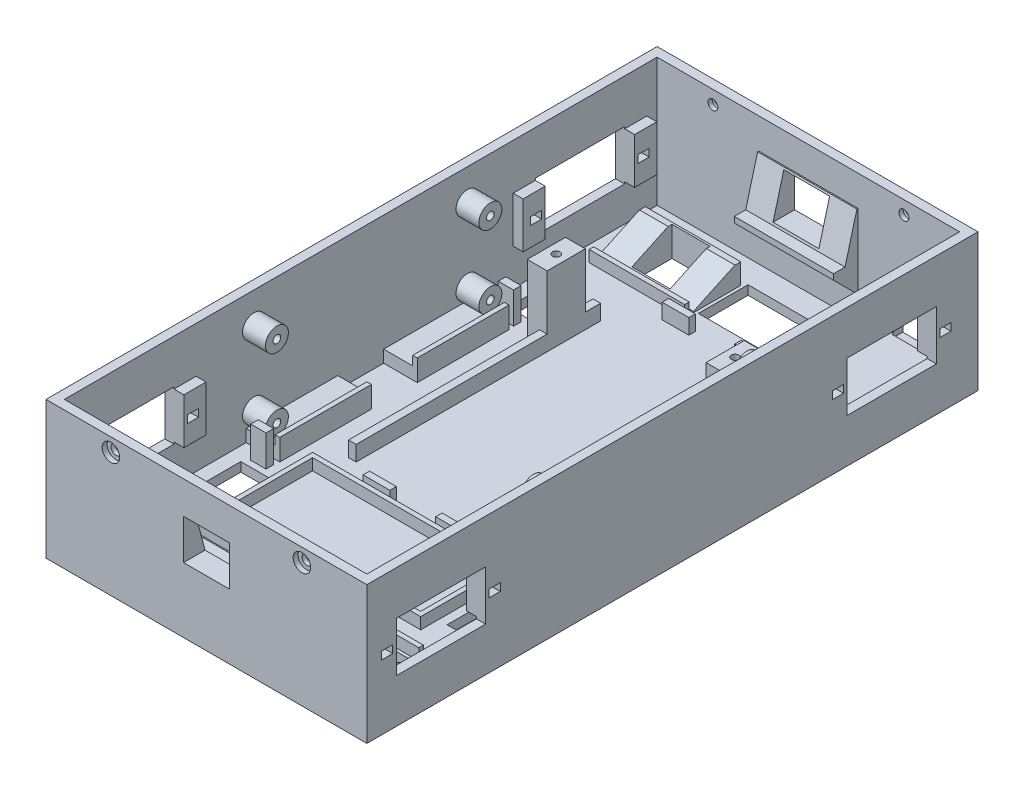
from build123d import *

# Parameters (mm, degrees)
BOSS_EXTRUDE1_START  = -80
SKETCH1_W            = 84
SKETCH1_H            = 36
BOSS_EXTRUDE1_DEPTH  = 160
BOSS_EXTRUDE2_START  = -77.6
SKETCH2_W            = 79.2
SKETCH2_H            = 38.6
BOSS_EXTRUDE2_DEPTH  = 155.2
BOSS_EXTRUDE3_START  = -74.9
SKETCH3_W            = 2.6
SKETCH3_H            = 12
BOSS_EXTRUDE3_DEPTH  = 35
BOSS_EXTRUDE4_START  = -69.1
SKETCH4_W            = 7.8
SKETCH4_H            = 13
BOSS_EXTRUDE4_DEPTH  = 23.4
BOSS_EXTRUDE5_START  = -72.925
SKETCH5_W            = 7.8
SKETCH5_H            = 2
BOSS_EXTRUDE5_DEPTH  = 2.9
BOSS_EXTRUDE6_START  = -44.775
SKETCH6_W            = 7.8
SKETCH6_H            = 2
BOSS_EXTRUDE6_DEPTH  = 2.9
BOSS_EXTRUDE7_START  = -45
SKETCH7_W            = 8
SKETCH7_H            = 4.4
BOSS_EXTRUDE7_DEPTH  = 10
BOSS_EXTRUDE8_START  = 43.1
SKETCH8_W            = 2.6
SKETCH8_H            = 12
BOSS_EXTRUDE8_DEPTH  = 34.5
BOSS_EXTRUDE9_START  = 48.9
SKETCH9_W            = 7.8
SKETCH9_H            = 13
BOSS_EXTRUDE9_DEPTH  = 23.4
BOSS_EXTRUDE10_START = 45.075
SKETCH10_W           = 7.8
SKETCH10_H           = 2
BOSS_EXTRUDE10_DEPTH = 2.9
BOSS_EXTRUDE11_START = 73.225
SKETCH11_W           = 7.8
SKETCH11_H           = 2
BOSS_EXTRUDE11_DEPTH = 2.9
BOSS_EXTRUDE12_START = 35
SKETCH12_W           = 8
SKETCH12_H           = 4.4
BOSS_EXTRUDE12_DEPTH = 10
BOSS_EXTRUDE13_START = -39.6
SKETCH13_R           = 3
BOSS_EXTRUDE13_DEPTH = 6
BOSS_EXTRUDE14_START = -40.4
SKETCH14_R           = 1
BOSS_EXTRUDE14_DEPTH = 7.4
BOSS_EXTRUDE15_START = -39.6
SKETCH15_R           = 3
BOSS_EXTRUDE15_DEPTH = 6
BOSS_EXTRUDE16_START = -40.4
SKETCH16_R           = 1
BOSS_EXTRUDE16_DEPTH = 7.4
BOSS_EXTRUDE17_START = -39.6
SKETCH17_R           = 3
BOSS_EXTRUDE17_DEPTH = 6
BOSS_EXTRUDE18_START = -40.4
SKETCH18_R           = 1
BOSS_EXTRUDE18_DEPTH = 7.4
BOSS_EXTRUDE19_START = -39.6
SKETCH19_R           = 3
BOSS_EXTRUDE19_DEPTH = 6
BOSS_EXTRUDE20_START = -40.4
SKETCH20_R           = 1
BOSS_EXTRUDE20_DEPTH = 7.4
BOSS_EXTRUDE21_START = -30
SKETCH21_W           = 7.6
SKETCH21_H           = 3.2
BOSS_EXTRUDE21_DEPTH = 24
BOSS_EXTRUDE22_START = -30
SKETCH22_W           = 1.2
SKETCH22_H           = 5.6
BOSS_EXTRUDE22_DEPTH = 24
BOSS_EXTRUDE23_START = 6
SKETCH23_W           = 7.6
SKETCH23_H           = 3.2
BOSS_EXTRUDE23_DEPTH = 24
BOSS_EXTRUDE24_START = 6
SKETCH24_W           = 1.2
SKETCH24_H           = 5.6
BOSS_EXTRUDE24_DEPTH = 24
BOSS_EXTRUDE25_START = 31.4
SKETCH25_W           = 4
SKETCH25_H           = 8.2
BOSS_EXTRUDE25_DEPTH = 2
BOSS_EXTRUDE26_START = -33.4
SKETCH26_W           = 4
SKETCH26_H           = 8.2
BOSS_EXTRUDE26_DEPTH = 2
BOSS_EXTRUDE27_START = -44
SKETCH27_W           = 2
SKETCH27_H           = 4
BOSS_EXTRUDE27_DEPTH = 64
BOSS_EXTRUDE28_START = -40
SKETCH28_W           = 5.2
SKETCH28_H           = 18.35
BOSS_EXTRUDE28_DEPTH = 10
BOSS_EXTRUDE29_START = 8
SKETCH29_R           = 1
BOSS_EXTRUDE29_DEPTH = 13.75
BOSS_EXTRUDE30_START = 27.7
SKETCH30_W           = 1.2
SKETCH30_H           = 3
BOSS_EXTRUDE30_DEPTH = 20.7
BOSS_EXTRUDE31_START = -74.9
SKETCH31_W           = 2.6
SKETCH31_H           = 12
BOSS_EXTRUDE31_DEPTH = 35
BOSS_EXTRUDE32_START = -69.1
SKETCH32_W           = 7.8
SKETCH32_H           = 13
BOSS_EXTRUDE32_DEPTH = 23.4
BOSS_EXTRUDE33_START = -72.925
SKETCH33_W           = 7.8
SKETCH33_H           = 2
BOSS_EXTRUDE33_DEPTH = 2.9
BOSS_EXTRUDE34_START = -44.775
SKETCH34_W           = 7.8
SKETCH34_H           = 2
BOSS_EXTRUDE34_DEPTH = 2.9
BOSS_EXTRUDE35_START = -45
SKETCH35_W           = 8
SKETCH35_H           = 4.4
BOSS_EXTRUDE35_DEPTH = 10
BOSS_EXTRUDE36_START = 43.1
SKETCH36_W           = 2.6
SKETCH36_H           = 12
BOSS_EXTRUDE36_DEPTH = 34.5
BOSS_EXTRUDE37_START = 48.9
SKETCH37_W           = 7.8
SKETCH37_H           = 13
BOSS_EXTRUDE37_DEPTH = 23.4
BOSS_EXTRUDE38_START = 45.075
SKETCH38_W           = 7.8
SKETCH38_H           = 2
BOSS_EXTRUDE38_DEPTH = 2.9
BOSS_EXTRUDE39_START = 73.225
SKETCH39_W           = 7.8
SKETCH39_H           = 2
BOSS_EXTRUDE39_DEPTH = 2.9
BOSS_EXTRUDE40_START = 35
SKETCH40_W           = 8
SKETCH40_H           = 4.4
BOSS_EXTRUDE40_DEPTH = 10
BOSS_EXTRUDE41_START = 33.6
SKETCH41_R           = 3
BOSS_EXTRUDE41_DEPTH = 6
BOSS_EXTRUDE42_START = 33
SKETCH42_R           = 1
BOSS_EXTRUDE42_DEPTH = 7.4
BOSS_EXTRUDE43_START = 33.6
SKETCH43_R           = 3
BOSS_EXTRUDE43_DEPTH = 6
BOSS_EXTRUDE44_START = 33
SKETCH44_R           = 1
BOSS_EXTRUDE44_DEPTH = 7.4
BOSS_EXTRUDE45_START = 33.6
SKETCH45_R           = 3
BOSS_EXTRUDE45_DEPTH = 6
BOSS_EXTRUDE46_START = 33
SKETCH46_R           = 1
BOSS_EXTRUDE46_DEPTH = 7.4
BOSS_EXTRUDE47_START = 33.6
SKETCH47_R           = 3
BOSS_EXTRUDE47_DEPTH = 6
BOSS_EXTRUDE48_START = 33
SKETCH48_R           = 1
BOSS_EXTRUDE48_DEPTH = 7.4
BOSS_EXTRUDE49_START = -30
SKETCH49_W           = 7.6
SKETCH49_H           = 3.2
BOSS_EXTRUDE49_DEPTH = 24
BOSS_EXTRUDE50_START = -30
SKETCH50_W           = 1.2
SKETCH50_H           = 5.6
BOSS_EXTRUDE50_DEPTH = 24
BOSS_EXTRUDE51_START = 6
SKETCH51_W           = 7.6
SKETCH51_H           = 3.2
BOSS_EXTRUDE51_DEPTH = 24
BOSS_EXTRUDE52_START = 6
SKETCH52_W           = 1.2
SKETCH52_H           = 5.6
BOSS_EXTRUDE52_DEPTH = 24
BOSS_EXTRUDE53_START = 31.4
SKETCH53_W           = 4
SKETCH53_H           = 8.2
BOSS_EXTRUDE53_DEPTH = 2
BOSS_EXTRUDE54_START = -33.4
SKETCH54_W           = 4
SKETCH54_H           = 8.2
BOSS_EXTRUDE54_DEPTH = 2
BOSS_EXTRUDE55_START = -44
SKETCH55_W           = 2
SKETCH55_H           = 4
BOSS_EXTRUDE55_DEPTH = 64
BOSS_EXTRUDE56_START = -40
SKETCH56_W           = 5.2
SKETCH56_H           = 18.35
BOSS_EXTRUDE56_DEPTH = 10
BOSS_EXTRUDE57_START = 8
SKETCH57_R           = 1
BOSS_EXTRUDE57_DEPTH = 13.75
BOSS_EXTRUDE58_START = 27.7
SKETCH58_W           = 1.2
SKETCH58_H           = 3
BOSS_EXTRUDE58_DEPTH = 20.7
BOSS_EXTRUDE59_START = 26.5
SKETCH59_W           = 51.4
SKETCH59_H           = 3
BOSS_EXTRUDE59_DEPTH = 1.2
BOSS_EXTRUDE60_START = 48.4
SKETCH60_W           = 51.4
SKETCH60_H           = 3
BOSS_EXTRUDE60_DEPTH = 1.2
BOSS_EXTRUDE61_START = -54
SKETCH61_W           = 7
SKETCH61_H           = 4
BOSS_EXTRUDE61_DEPTH = 1.7
BOSS_EXTRUDE62_START = -54
SKETCH62_W           = 7
SKETCH62_H           = 4
BOSS_EXTRUDE62_DEPTH = 1.7
BOSS_EXTRUDE63_START = 24.3
SKETCH63_W           = 7
SKETCH63_H           = 4
BOSS_EXTRUDE63_DEPTH = 1.7
BOSS_EXTRUDE64_START = 24.3
SKETCH64_W           = 7
SKETCH64_H           = 4
BOSS_EXTRUDE64_DEPTH = 1.7
BOSS_EXTRUDE65_START = -32.5
BOSS_EXTRUDE65_DEPTH = 25
BOSS_EXTRUDE66_START = 55.7
SKETCH66_W           = 25
SKETCH66_H           = 3
BOSS_EXTRUDE66_DEPTH = 1.2
BOSS_EXTRUDE67_START = 59.4
SKETCH67_W           = 10
SKETCH67_H           = 9.771419141
BOSS_EXTRUDE67_DEPTH = 10.475693444
BOSS_EXTRUDE68_START = 7.5
BOSS_EXTRUDE68_DEPTH = 25
BOSS_EXTRUDE69_START = 55.7
SKETCH69_W           = 25
SKETCH69_H           = 3
BOSS_EXTRUDE69_DEPTH = 1.2
BOSS_EXTRUDE70_START = 59.4
SKETCH70_W           = 10
SKETCH70_H           = 9.771419141
BOSS_EXTRUDE70_DEPTH = 10.475693444
BOSS_EXTRUDE71_START = -35.5
BOSS_EXTRUDE71_DEPTH = 25
BOSS_EXTRUDE72_START = -56.9
SKETCH72_W           = 25
SKETCH72_H           = 3
BOSS_EXTRUDE72_DEPTH = 1.2
BOSS_EXTRUDE73_START = -69.875693444
SKETCH73_W           = 10
SKETCH73_H           = 9.771419141
BOSS_EXTRUDE73_DEPTH = 10.475693444
BOSS_EXTRUDE74_START = -13
BOSS_EXTRUDE74_DEPTH = 26
BOSS_EXTRUDE75_START = -81
SKETCH75_W           = 12
SKETCH75_H           = 10.5
BOSS_EXTRUDE75_DEPTH = 7
BOSS_EXTRUDE76_START = -13
BOSS_EXTRUDE76_DEPTH = 26
BOSS_EXTRUDE77_START = 74
SKETCH77_W           = 12
SKETCH77_H           = 10.5
BOSS_EXTRUDE77_DEPTH = 7
BOSS_EXTRUDE78_START = -71.5
SKETCH78_W           = 19.4
SKETCH78_H           = 4.4
BOSS_EXTRUDE78_DEPTH = 13
BOSS_EXTRUDE79_START = -77.6
SKETCH79_W           = 18
SKETCH79_H           = 2
BOSS_EXTRUDE79_DEPTH = 31
BOSS_EXTRUDE80_START = -75
SKETCH80_W           = 1.8
SKETCH80_H           = 5
BOSS_EXTRUDE80_DEPTH = 22
BOSS_EXTRUDE81_START = -46.4
SKETCH81_W           = 18.3
SKETCH81_H           = 5
BOSS_EXTRUDE81_DEPTH = 1.2
BOSS_EXTRUDE82_START = -81
SKETCH82_W           = 16
SKETCH82_H           = 9
BOSS_EXTRUDE82_DEPTH = 3.9
BOSS_EXTRUDE83_START = -81
SKETCH83_R           = 1.3
BOSS_EXTRUDE83_DEPTH = 4.4
BOSS_EXTRUDE84_START = -81
SKETCH84_R           = 2.3
BOSS_EXTRUDE84_DEPTH = 2.3
BOSS_EXTRUDE85_START = -81
SKETCH85_R           = 1.3
BOSS_EXTRUDE85_DEPTH = 4.4
BOSS_EXTRUDE86_START = -81
SKETCH86_R           = 2.3
BOSS_EXTRUDE86_DEPTH = 2.3
BOSS_EXTRUDE87_START = 76.6
SKETCH87_R           = 1.3
BOSS_EXTRUDE87_DEPTH = 4.4
BOSS_EXTRUDE88_START = 78.7
SKETCH88_R           = 2.3
BOSS_EXTRUDE88_DEPTH = 2.3
BOSS_EXTRUDE89_START = 76.6
SKETCH89_R           = 1.3
BOSS_EXTRUDE89_DEPTH = 4.4
BOSS_EXTRUDE90_START = 78.7
SKETCH90_R           = 2.3
BOSS_EXTRUDE90_DEPTH = 2.3


with BuildPart() as part:
    # Sketch1 → Boss-Extrude1 (new body)
    with BuildSketch(Plane.XY.offset(BOSS_EXTRUDE1_START)):
        with Locations((0, 18)):
            Rectangle(SKETCH1_W, SKETCH1_H)
    extrude(amount=BOSS_EXTRUDE1_DEPTH)


with BuildPart() as body_2:
    # Sketch2 → Boss-Extrude2 (new body)
    with BuildSketch(Plane.XY.offset(BOSS_EXTRUDE2_START)):
        with Locations((0, 21.7)):
            Rectangle(SKETCH2_W, SKETCH2_H)
    extrude(amount=BOSS_EXTRUDE2_DEPTH)


with BuildPart() as part_1:
    add(part.part)

    # Combine1: cut body 2
    add(body_2.part, mode=Mode.SUBTRACT)

    # Sketch3 → Boss-Extrude3 (add)
    with BuildSketch(Plane.XY.offset(BOSS_EXTRUDE3_START)):
        with Locations((-38.3, 18)):
            Rectangle(SKETCH3_W, SKETCH3_H)
    extrude(amount=BOSS_EXTRUDE3_DEPTH)


with BuildPart() as body_2_2:
    # Sketch4 → Boss-Extrude4 (new body)
    with BuildSketch(Plane.XY.offset(BOSS_EXTRUDE4_START)):
        with Locations((-39.1, 18)):
            Rectangle(SKETCH4_W, SKETCH4_H)
    extrude(amount=BOSS_EXTRUDE4_DEPTH)


with BuildPart() as part_2:
    add(part_1.part)

    # Combine2: cut body 2 2
    add(body_2_2.part, mode=Mode.SUBTRACT)


with BuildPart() as body_2_3:
    # Sketch5 → Boss-Extrude5 (new body)
    with BuildSketch(Plane.XY.offset(BOSS_EXTRUDE5_START)):
        with Locations((-39.1, 18)):
            Rectangle(SKETCH5_W, SKETCH5_H)
    extrude(amount=BOSS_EXTRUDE5_DEPTH)


with BuildPart() as part_3:
    add(part_2.part)

    # Combine3: cut body 2 3
    add(body_2_3.part, mode=Mode.SUBTRACT)


with BuildPart() as body_2_4:
    # Sketch6 → Boss-Extrude6 (new body)
    with BuildSketch(Plane.XY.offset(BOSS_EXTRUDE6_START)):
        with Locations((-39.1, 18)):
            Rectangle(SKETCH6_W, SKETCH6_H)
    extrude(amount=BOSS_EXTRUDE6_DEPTH)


with BuildPart() as part_4:
    add(part_3.part)

    # Combine4: cut body 2 4
    add(body_2_4.part, mode=Mode.SUBTRACT)


with BuildPart() as body_2_5:
    # Sketch7 → Boss-Extrude7 (new body)
    with BuildSketch(Plane.XY.offset(BOSS_EXTRUDE7_START)):
        with Locations((-32, 1.2)):
            Rectangle(SKETCH7_W, SKETCH7_H)
    extrude(amount=BOSS_EXTRUDE7_DEPTH)


with BuildPart() as part_5:
    add(part_4.part)

    # Combine5: cut body 2 5
    add(body_2_5.part, mode=Mode.SUBTRACT)

    # Sketch8 → Boss-Extrude8 (add)
    with BuildSketch(Plane.XY.offset(BOSS_EXTRUDE8_START)):
        with Locations((-38.3, 18)):
            Rectangle(SKETCH8_W, SKETCH8_H)
    extrude(amount=BOSS_EXTRUDE8_DEPTH)


with BuildPart() as body_2_6:
    # Sketch9 → Boss-Extrude9 (new body)
    with BuildSketch(Plane.XY.offset(BOSS_EXTRUDE9_START)):
        with Locations((-39.1, 18)):
            Rectangle(SKETCH9_W, SKETCH9_H)
    extrude(amount=BOSS_EXTRUDE9_DEPTH)


with BuildPart() as part_6:
    add(part_5.part)

    # Combine6: cut body 2 6
    add(body_2_6.part, mode=Mode.SUBTRACT)


with BuildPart() as body_2_7:
    # Sketch10 → Boss-Extrude10 (new body)
    with BuildSketch(Plane.XY.offset(BOSS_EXTRUDE10_START)):
        with Locations((-39.1, 18)):
            Rectangle(SKETCH10_W, SKETCH10_H)
    extrude(amount=BOSS_EXTRUDE10_DEPTH)


with BuildPart() as part_7:
    add(part_6.part)

    # Combine7: cut body 2 7
    add(body_2_7.part, mode=Mode.SUBTRACT)


with BuildPart() as body_2_8:
    # Sketch11 → Boss-Extrude11 (new body)
    with BuildSketch(Plane.XY.offset(BOSS_EXTRUDE11_START)):
        with Locations((-39.1, 18)):
            Rectangle(SKETCH11_W, SKETCH11_H)
    extrude(amount=BOSS_EXTRUDE11_DEPTH)


with BuildPart() as part_8:
    add(part_7.part)

    # Combine8: cut body 2 8
    add(body_2_8.part, mode=Mode.SUBTRACT)


with BuildPart() as body_2_9:
    # Sketch12 → Boss-Extrude12 (new body)
    with BuildSketch(Plane.XY.offset(BOSS_EXTRUDE12_START)):
        with Locations((-32, 1.2)):
            Rectangle(SKETCH12_W, SKETCH12_H)
    extrude(amount=BOSS_EXTRUDE12_DEPTH)


with BuildPart() as part_9:
    add(part_8.part)

    # Combine9: cut body 2 9
    add(body_2_9.part, mode=Mode.SUBTRACT)

    # Sketch13 → Boss-Extrude13 (add)
    with BuildSketch(Plane(origin=(0, 0, 0), x_dir=(0, 0, -1), z_dir=(1, 0, 0)).offset(BOSS_EXTRUDE13_START)):
        with Locations((27.94, 8.775)):
            Circle(SKETCH13_R)
    extrude(amount=BOSS_EXTRUDE13_DEPTH)


with BuildPart() as body_2_10:
    # Sketch14 → Boss-Extrude14 (new body)
    with BuildSketch(Plane(origin=(0, 0, 0), x_dir=(0, 0, -1), z_dir=(1, 0, 0)).offset(BOSS_EXTRUDE14_START)):
        with Locations((27.94, 8.775)):
            Circle(SKETCH14_R)
    extrude(amount=BOSS_EXTRUDE14_DEPTH)


with BuildPart() as part_10:
    add(part_9.part)

    # Combine10: cut body 2 10
    add(body_2_10.part, mode=Mode.SUBTRACT)

    # Sketch15 → Boss-Extrude15 (add)
    with BuildSketch(Plane(origin=(0, 0, 0), x_dir=(0, 0, -1), z_dir=(1, 0, 0)).offset(BOSS_EXTRUDE15_START)):
        with Locations((27.94, 27.825)):
            Circle(SKETCH15_R)
    extrude(amount=BOSS_EXTRUDE15_DEPTH)


with BuildPart() as body_2_11:
    # Sketch16 → Boss-Extrude16 (new body)
    with BuildSketch(Plane(origin=(0, 0, 0), x_dir=(0, 0, -1), z_dir=(1, 0, 0)).offset(BOSS_EXTRUDE16_START)):
        with Locations((27.94, 27.825)):
            Circle(SKETCH16_R)
    extrude(amount=BOSS_EXTRUDE16_DEPTH)


with BuildPart() as part_11:
    add(part_10.part)

    # Combine11: cut body 2 11
    add(body_2_11.part, mode=Mode.SUBTRACT)

    # Sketch17 → Boss-Extrude17 (add)
    with BuildSketch(Plane(origin=(0, 0, 0), x_dir=(0, 0, -1), z_dir=(1, 0, 0)).offset(BOSS_EXTRUDE17_START)):
        with Locations((-27.94, 8.775)):
            Circle(SKETCH17_R)
    extrude(amount=BOSS_EXTRUDE17_DEPTH)


with BuildPart() as body_2_12:
    # Sketch18 → Boss-Extrude18 (new body)
    with BuildSketch(Plane(origin=(0, 0, 0), x_dir=(0, 0, -1), z_dir=(1, 0, 0)).offset(BOSS_EXTRUDE18_START)):
        with Locations((-27.94, 8.775)):
            Circle(SKETCH18_R)
    extrude(amount=BOSS_EXTRUDE18_DEPTH)


with BuildPart() as part_12:
    add(part_11.part)

    # Combine12: cut body 2 12
    add(body_2_12.part, mode=Mode.SUBTRACT)

    # Sketch19 → Boss-Extrude19 (add)
    with BuildSketch(Plane(origin=(0, 0, 0), x_dir=(0, 0, -1), z_dir=(1, 0, 0)).offset(BOSS_EXTRUDE19_START)):
        with Locations((-27.94, 27.825)):
            Circle(SKETCH19_R)
    extrude(amount=BOSS_EXTRUDE19_DEPTH)


with BuildPart() as body_2_13:
    # Sketch20 → Boss-Extrude20 (new body)
    with BuildSketch(Plane(origin=(0, 0, 0), x_dir=(0, 0, -1), z_dir=(1, 0, 0)).offset(BOSS_EXTRUDE20_START)):
        with Locations((-27.94, 27.825)):
            Circle(SKETCH20_R)
    extrude(amount=BOSS_EXTRUDE20_DEPTH)


with BuildPart() as part_13:
    add(part_12.part)

    # Combine13: cut body 2 13
    add(body_2_13.part, mode=Mode.SUBTRACT)

    # Sketch21 → Boss-Extrude21 (add)
    with BuildSketch(Plane.XY.offset(BOSS_EXTRUDE21_START)):
        with Locations((-35.8, 4)):
            Rectangle(SKETCH21_W, SKETCH21_H)
    extrude(amount=BOSS_EXTRUDE21_DEPTH)

    # Sketch22 → Boss-Extrude22 (add)
    with BuildSketch(Plane.XY.offset(BOSS_EXTRUDE22_START)):
        with Locations((-31.4, 5.2)):
            Rectangle(SKETCH22_W, SKETCH22_H)
    extrude(amount=BOSS_EXTRUDE22_DEPTH)

    # Sketch23 → Boss-Extrude23 (add)
    with BuildSketch(Plane.XY.offset(BOSS_EXTRUDE23_START)):
        with Locations((-35.8, 4)):
            Rectangle(SKETCH23_W, SKETCH23_H)
    extrude(amount=BOSS_EXTRUDE23_DEPTH)

    # Sketch24 → Boss-Extrude24 (add)
    with BuildSketch(Plane.XY.offset(BOSS_EXTRUDE24_START)):
        with Locations((-31.4, 5.2)):
            Rectangle(SKETCH24_W, SKETCH24_H)
    extrude(amount=BOSS_EXTRUDE24_DEPTH)

    # Sketch25 → Boss-Extrude25 (add)
    with BuildSketch(Plane.XY.offset(BOSS_EXTRUDE25_START)):
        with Locations((-33, 6.5)):
            Rectangle(SKETCH25_W, SKETCH25_H)
    extrude(amount=BOSS_EXTRUDE25_DEPTH)

    # Sketch26 → Boss-Extrude26 (add)
    with BuildSketch(Plane.XY.offset(BOSS_EXTRUDE26_START)):
        with Locations((-33, 6.5)):
            Rectangle(SKETCH26_W, SKETCH26_H)
    extrude(amount=BOSS_EXTRUDE26_DEPTH)

    # Sketch27 → Boss-Extrude27 (add)
    with BuildSketch(Plane.XY.offset(BOSS_EXTRUDE27_START)):
        with Locations((-21.8, 4.4)):
            Rectangle(SKETCH27_W, SKETCH27_H)
    extrude(amount=BOSS_EXTRUDE27_DEPTH)

    # Sketch28 → Boss-Extrude28 (add)
    with BuildSketch(Plane.XY.offset(BOSS_EXTRUDE28_START)):
        with Locations((-23.4, 11.575)):
            Rectangle(SKETCH28_W, SKETCH28_H)
    extrude(amount=BOSS_EXTRUDE28_DEPTH)


with BuildPart() as body_2_14:
    # Sketch29 → Boss-Extrude29 (new body)
    with BuildSketch(Plane(origin=(0, 0, 0), x_dir=(1, 0, 0), z_dir=(0, 1, 0)).offset(BOSS_EXTRUDE29_START)):
        with Locations((-23.4, 35)):
            Circle(SKETCH29_R)
    extrude(amount=BOSS_EXTRUDE29_DEPTH)


with BuildPart() as part_14:
    add(part_13.part)

    # Combine14: cut body 2 14
    add(body_2_14.part, mode=Mode.SUBTRACT)

    # Sketch30 → Boss-Extrude30 (add)
    with BuildSketch(Plane.XY.offset(BOSS_EXTRUDE30_START)):
        with Locations((-25.1, 3.9)):
            Rectangle(SKETCH30_W, SKETCH30_H)
    extrude(amount=BOSS_EXTRUDE30_DEPTH)

    # Sketch31 → Boss-Extrude31 (add)
    with BuildSketch(Plane.XY.offset(BOSS_EXTRUDE31_START)):
        with Locations((38.3, 18)):
            Rectangle(SKETCH31_W, SKETCH31_H)
    extrude(amount=BOSS_EXTRUDE31_DEPTH)


with BuildPart() as body_2_15:
    # Sketch32 → Boss-Extrude32 (new body)
    with BuildSketch(Plane.XY.offset(BOSS_EXTRUDE32_START)):
        with Locations((39.1, 18)):
            Rectangle(SKETCH32_W, SKETCH32_H)
    extrude(amount=BOSS_EXTRUDE32_DEPTH)


with BuildPart() as part_15:
    add(part_14.part)

    # Combine15: cut body 2 15
    add(body_2_15.part, mode=Mode.SUBTRACT)


with BuildPart() as body_2_16:
    # Sketch33 → Boss-Extrude33 (new body)
    with BuildSketch(Plane.XY.offset(BOSS_EXTRUDE33_START)):
        with Locations((39.1, 18)):
            Rectangle(SKETCH33_W, SKETCH33_H)
    extrude(amount=BOSS_EXTRUDE33_DEPTH)


with BuildPart() as part_16:
    add(part_15.part)

    # Combine16: cut body 2 16
    add(body_2_16.part, mode=Mode.SUBTRACT)


with BuildPart() as body_2_17:
    # Sketch34 → Boss-Extrude34 (new body)
    with BuildSketch(Plane.XY.offset(BOSS_EXTRUDE34_START)):
        with Locations((39.1, 18)):
            Rectangle(SKETCH34_W, SKETCH34_H)
    extrude(amount=BOSS_EXTRUDE34_DEPTH)


with BuildPart() as part_17:
    add(part_16.part)

    # Combine17: cut body 2 17
    add(body_2_17.part, mode=Mode.SUBTRACT)


with BuildPart() as body_2_18:
    # Sketch35 → Boss-Extrude35 (new body)
    with BuildSketch(Plane.XY.offset(BOSS_EXTRUDE35_START)):
        with Locations((32, 1.2)):
            Rectangle(SKETCH35_W, SKETCH35_H)
    extrude(amount=BOSS_EXTRUDE35_DEPTH)


with BuildPart() as part_18:
    add(part_17.part)

    # Combine18: cut body 2 18
    add(body_2_18.part, mode=Mode.SUBTRACT)

    # Sketch36 → Boss-Extrude36 (add)
    with BuildSketch(Plane.XY.offset(BOSS_EXTRUDE36_START)):
        with Locations((38.3, 18)):
            Rectangle(SKETCH36_W, SKETCH36_H)
    extrude(amount=BOSS_EXTRUDE36_DEPTH)


with BuildPart() as body_2_19:
    # Sketch37 → Boss-Extrude37 (new body)
    with BuildSketch(Plane.XY.offset(BOSS_EXTRUDE37_START)):
        with Locations((39.1, 18)):
            Rectangle(SKETCH37_W, SKETCH37_H)
    extrude(amount=BOSS_EXTRUDE37_DEPTH)


with BuildPart() as part_19:
    add(part_18.part)

    # Combine19: cut body 2 19
    add(body_2_19.part, mode=Mode.SUBTRACT)


with BuildPart() as body_2_20:
    # Sketch38 → Boss-Extrude38 (new body)
    with BuildSketch(Plane.XY.offset(BOSS_EXTRUDE38_START)):
        with Locations((39.1, 18)):
            Rectangle(SKETCH38_W, SKETCH38_H)
    extrude(amount=BOSS_EXTRUDE38_DEPTH)


with BuildPart() as part_20:
    add(part_19.part)

    # Combine20: cut body 2 20
    add(body_2_20.part, mode=Mode.SUBTRACT)


with BuildPart() as body_2_21:
    # Sketch39 → Boss-Extrude39 (new body)
    with BuildSketch(Plane.XY.offset(BOSS_EXTRUDE39_START)):
        with Locations((39.1, 18)):
            Rectangle(SKETCH39_W, SKETCH39_H)
    extrude(amount=BOSS_EXTRUDE39_DEPTH)


with BuildPart() as part_21:
    add(part_20.part)

    # Combine21: cut body 2 21
    add(body_2_21.part, mode=Mode.SUBTRACT)


with BuildPart() as body_2_22:
    # Sketch40 → Boss-Extrude40 (new body)
    with BuildSketch(Plane.XY.offset(BOSS_EXTRUDE40_START)):
        with Locations((32, 1.2)):
            Rectangle(SKETCH40_W, SKETCH40_H)
    extrude(amount=BOSS_EXTRUDE40_DEPTH)


with BuildPart() as part_22:
    add(part_21.part)

    # Combine22: cut body 2 22
    add(body_2_22.part, mode=Mode.SUBTRACT)

    # Sketch41 → Boss-Extrude41 (add)
    with BuildSketch(Plane(origin=(0, 0, 0), x_dir=(0, 0, -1), z_dir=(1, 0, 0)).offset(BOSS_EXTRUDE41_START)):
        with Locations((27.94, 8.775)):
            Circle(SKETCH41_R)
    extrude(amount=BOSS_EXTRUDE41_DEPTH)


with BuildPart() as body_2_23:
    # Sketch42 → Boss-Extrude42 (new body)
    with BuildSketch(Plane(origin=(0, 0, 0), x_dir=(0, 0, -1), z_dir=(1, 0, 0)).offset(BOSS_EXTRUDE42_START)):
        with Locations((27.94, 8.775)):
            Circle(SKETCH42_R)
    extrude(amount=BOSS_EXTRUDE42_DEPTH)


with BuildPart() as part_23:
    add(part_22.part)

    # Combine23: cut body 2 23
    add(body_2_23.part, mode=Mode.SUBTRACT)

    # Sketch43 → Boss-Extrude43 (add)
    with BuildSketch(Plane(origin=(0, 0, 0), x_dir=(0, 0, -1), z_dir=(1, 0, 0)).offset(BOSS_EXTRUDE43_START)):
        with Locations((27.94, 27.825)):
            Circle(SKETCH43_R)
    extrude(amount=BOSS_EXTRUDE43_DEPTH)


with BuildPart() as body_2_24:
    # Sketch44 → Boss-Extrude44 (new body)
    with BuildSketch(Plane(origin=(0, 0, 0), x_dir=(0, 0, -1), z_dir=(1, 0, 0)).offset(BOSS_EXTRUDE44_START)):
        with Locations((27.94, 27.825)):
            Circle(SKETCH44_R)
    extrude(amount=BOSS_EXTRUDE44_DEPTH)


with BuildPart() as part_24:
    add(part_23.part)

    # Combine24: cut body 2 24
    add(body_2_24.part, mode=Mode.SUBTRACT)

    # Sketch45 → Boss-Extrude45 (add)
    with BuildSketch(Plane(origin=(0, 0, 0), x_dir=(0, 0, -1), z_dir=(1, 0, 0)).offset(BOSS_EXTRUDE45_START)):
        with Locations((-27.94, 8.775)):
            Circle(SKETCH45_R)
    extrude(amount=BOSS_EXTRUDE45_DEPTH)


with BuildPart() as body_2_25:
    # Sketch46 → Boss-Extrude46 (new body)
    with BuildSketch(Plane(origin=(0, 0, 0), x_dir=(0, 0, -1), z_dir=(1, 0, 0)).offset(BOSS_EXTRUDE46_START)):
        with Locations((-27.94, 8.775)):
            Circle(SKETCH46_R)
    extrude(amount=BOSS_EXTRUDE46_DEPTH)


with BuildPart() as part_25:
    add(part_24.part)

    # Combine25: cut body 2 25
    add(body_2_25.part, mode=Mode.SUBTRACT)

    # Sketch47 → Boss-Extrude47 (add)
    with BuildSketch(Plane(origin=(0, 0, 0), x_dir=(0, 0, -1), z_dir=(1, 0, 0)).offset(BOSS_EXTRUDE47_START)):
        with Locations((-27.94, 27.825)):
            Circle(SKETCH47_R)
    extrude(amount=BOSS_EXTRUDE47_DEPTH)


with BuildPart() as body_2_26:
    # Sketch48 → Boss-Extrude48 (new body)
    with BuildSketch(Plane(origin=(0, 0, 0), x_dir=(0, 0, -1), z_dir=(1, 0, 0)).offset(BOSS_EXTRUDE48_START)):
        with Locations((-27.94, 27.825)):
            Circle(SKETCH48_R)
    extrude(amount=BOSS_EXTRUDE48_DEPTH)


with BuildPart() as part_26:
    add(part_25.part)

    # Combine26: cut body 2 26
    add(body_2_26.part, mode=Mode.SUBTRACT)

    # Sketch49 → Boss-Extrude49 (add)
    with BuildSketch(Plane.XY.offset(BOSS_EXTRUDE49_START)):
        with Locations((35.8, 4)):
            Rectangle(SKETCH49_W, SKETCH49_H)
    extrude(amount=BOSS_EXTRUDE49_DEPTH)

    # Sketch50 → Boss-Extrude50 (add)
    with BuildSketch(Plane.XY.offset(BOSS_EXTRUDE50_START)):
        with Locations((31.4, 5.2)):
            Rectangle(SKETCH50_W, SKETCH50_H)
    extrude(amount=BOSS_EXTRUDE50_DEPTH)

    # Sketch51 → Boss-Extrude51 (add)
    with BuildSketch(Plane.XY.offset(BOSS_EXTRUDE51_START)):
        with Locations((35.8, 4)):
            Rectangle(SKETCH51_W, SKETCH51_H)
    extrude(amount=BOSS_EXTRUDE51_DEPTH)

    # Sketch52 → Boss-Extrude52 (add)
    with BuildSketch(Plane.XY.offset(BOSS_EXTRUDE52_START)):
        with Locations((31.4, 5.2)):
            Rectangle(SKETCH52_W, SKETCH52_H)
    extrude(amount=BOSS_EXTRUDE52_DEPTH)

    # Sketch53 → Boss-Extrude53 (add)
    with BuildSketch(Plane.XY.offset(BOSS_EXTRUDE53_START)):
        with Locations((33, 6.5)):
            Rectangle(SKETCH53_W, SKETCH53_H)
    extrude(amount=BOSS_EXTRUDE53_DEPTH)

    # Sketch54 → Boss-Extrude54 (add)
    with BuildSketch(Plane.XY.offset(BOSS_EXTRUDE54_START)):
        with Locations((33, 6.5)):
            Rectangle(SKETCH54_W, SKETCH54_H)
    extrude(amount=BOSS_EXTRUDE54_DEPTH)

    # Sketch55 → Boss-Extrude55 (add)
    with BuildSketch(Plane.XY.offset(BOSS_EXTRUDE55_START)):
        with Locations((21.8, 4.4)):
            Rectangle(SKETCH55_W, SKETCH55_H)
    extrude(amount=BOSS_EXTRUDE55_DEPTH)

    # Sketch56 → Boss-Extrude56 (add)
    with BuildSketch(Plane.XY.offset(BOSS_EXTRUDE56_START)):
        with Locations((23.4, 11.575)):
            Rectangle(SKETCH56_W, SKETCH56_H)
    extrude(amount=BOSS_EXTRUDE56_DEPTH)


with BuildPart() as body_2_27:
    # Sketch57 → Boss-Extrude57 (new body)
    with BuildSketch(Plane(origin=(0, 0, 0), x_dir=(1, 0, 0), z_dir=(0, 1, 0)).offset(BOSS_EXTRUDE57_START)):
        with Locations((23.4, 35)):
            Circle(SKETCH57_R)
    extrude(amount=BOSS_EXTRUDE57_DEPTH)


with BuildPart() as part_27:
    add(part_26.part)

    # Combine27: cut body 2 27
    add(body_2_27.part, mode=Mode.SUBTRACT)

    # Sketch58 → Boss-Extrude58 (add)
    with BuildSketch(Plane.XY.offset(BOSS_EXTRUDE58_START)):
        with Locations((25.1, 3.9)):
            Rectangle(SKETCH58_W, SKETCH58_H)
    extrude(amount=BOSS_EXTRUDE58_DEPTH)

    # Sketch59 → Boss-Extrude59 (add)
    with BuildSketch(Plane.XY.offset(BOSS_EXTRUDE59_START)):
        with Locations((0, 3.9)):
            Rectangle(SKETCH59_W, SKETCH59_H)
    extrude(amount=BOSS_EXTRUDE59_DEPTH)

    # Sketch60 → Boss-Extrude60 (add)
    with BuildSketch(Plane.XY.offset(BOSS_EXTRUDE60_START)):
        with Locations((0, 3.9)):
            Rectangle(SKETCH60_W, SKETCH60_H)
    extrude(amount=BOSS_EXTRUDE60_DEPTH)

    # Sketch61 → Boss-Extrude61 (add)
    with BuildSketch(Plane.XY.offset(BOSS_EXTRUDE61_START)):
        with Locations((-9.5, 4.4)):
            Rectangle(SKETCH61_W, SKETCH61_H)
    extrude(amount=BOSS_EXTRUDE61_DEPTH)

    # Sketch62 → Boss-Extrude62 (add)
    with BuildSketch(Plane.XY.offset(BOSS_EXTRUDE62_START)):
        with Locations((9.5, 4.4)):
            Rectangle(SKETCH62_W, SKETCH62_H)
    extrude(amount=BOSS_EXTRUDE62_DEPTH)

    # Sketch63 → Boss-Extrude63 (add)
    with BuildSketch(Plane.XY.offset(BOSS_EXTRUDE63_START)):
        with Locations((-9.5, 4.4)):
            Rectangle(SKETCH63_W, SKETCH63_H)
    extrude(amount=BOSS_EXTRUDE63_DEPTH)

    # Sketch64 → Boss-Extrude64 (add)
    with BuildSketch(Plane.XY.offset(BOSS_EXTRUDE64_START)):
        with Locations((9.5, 4.4)):
            Rectangle(SKETCH64_W, SKETCH64_H)
    extrude(amount=BOSS_EXTRUDE64_DEPTH)

    # Sketch65 → Boss-Extrude65 (add)
    with BuildSketch(Plane(origin=(0, 0, 0), x_dir=(0, 0, -1), z_dir=(1, 0, 0)).offset(BOSS_EXTRUDE65_START)):
        Polygon((-58, 2.4), (-58, 2.7), (-68.875693444, 7.771419141), (-70.375693444, 7.771419141), (-70.375693444, 2.4), align=None)
    extrude(amount=BOSS_EXTRUDE65_DEPTH)

    # Sketch66 → Boss-Extrude66 (add)
    with BuildSketch(Plane.XY.offset(BOSS_EXTRUDE66_START)):
        with Locations((-20, 3.9)):
            Rectangle(SKETCH66_W, SKETCH66_H)
    extrude(amount=BOSS_EXTRUDE66_DEPTH)


with BuildPart() as body_2_28:
    # Sketch67 → Boss-Extrude67 (new body)
    with BuildSketch(Plane.XY.offset(BOSS_EXTRUDE67_START)):
        with Locations((-20, 3.885709571)):
            Rectangle(SKETCH67_W, SKETCH67_H)
    extrude(amount=BOSS_EXTRUDE67_DEPTH)


with BuildPart() as part_28:
    add(part_27.part)

    # Combine28: cut body 2 28
    add(body_2_28.part, mode=Mode.SUBTRACT)

    # Sketch68 → Boss-Extrude68 (add)
    with BuildSketch(Plane(origin=(0, 0, 0), x_dir=(0, 0, -1), z_dir=(1, 0, 0)).offset(BOSS_EXTRUDE68_START)):
        Polygon((-58, 2.4), (-58, 2.7), (-68.875693444, 7.771419141), (-70.375693444, 7.771419141), (-70.375693444, 2.4), align=None)
    extrude(amount=BOSS_EXTRUDE68_DEPTH)

    # Sketch69 → Boss-Extrude69 (add)
    with BuildSketch(Plane.XY.offset(BOSS_EXTRUDE69_START)):
        with Locations((20, 3.9)):
            Rectangle(SKETCH69_W, SKETCH69_H)
    extrude(amount=BOSS_EXTRUDE69_DEPTH)


with BuildPart() as body_2_29:
    # Sketch70 → Boss-Extrude70 (new body)
    with BuildSketch(Plane.XY.offset(BOSS_EXTRUDE70_START)):
        with Locations((20, 3.885709571)):
            Rectangle(SKETCH70_W, SKETCH70_H)
    extrude(amount=BOSS_EXTRUDE70_DEPTH)


with BuildPart() as part_29:
    add(part_28.part)

    # Combine29: cut body 2 29
    add(body_2_29.part, mode=Mode.SUBTRACT)

    # Sketch71 → Boss-Extrude71 (add)
    with BuildSketch(Plane(origin=(0, 0, 0), x_dir=(0, 0, -1), z_dir=(1, 0, 0)).offset(BOSS_EXTRUDE71_START)):
        Polygon((58, 2.4), (58, 2.7), (68.875693444, 7.771419141), (70.375693444, 7.771419141), (70.375693444, 2.4), align=None)
    extrude(amount=BOSS_EXTRUDE71_DEPTH)

    # Sketch72 → Boss-Extrude72 (add)
    with BuildSketch(Plane.XY.offset(BOSS_EXTRUDE72_START)):
        with Locations((-23, 3.9)):
            Rectangle(SKETCH72_W, SKETCH72_H)
    extrude(amount=BOSS_EXTRUDE72_DEPTH)


with BuildPart() as body_2_30:
    # Sketch73 → Boss-Extrude73 (new body)
    with BuildSketch(Plane.XY.offset(BOSS_EXTRUDE73_START)):
        with Locations((-23, 3.885709571)):
            Rectangle(SKETCH73_W, SKETCH73_H)
    extrude(amount=BOSS_EXTRUDE73_DEPTH)


with BuildPart() as part_30:
    add(part_29.part)

    # Combine30: cut body 2 30
    add(body_2_30.part, mode=Mode.SUBTRACT)

    # Sketch74 → Boss-Extrude74 (add)
    with BuildSketch(Plane(origin=(0, 0, 0), x_dir=(0, 0, -1), z_dir=(1, 0, 0)).offset(BOSS_EXTRUDE74_START)):
        Polygon((77.6, 8.5), (71.2, 14.9), (71.2, 16.4), (74.19, 16.4), (77.3, 28), (77.6, 28), align=None)
    extrude(amount=BOSS_EXTRUDE74_DEPTH)


with BuildPart() as body_2_31:
    # Sketch75 → Boss-Extrude75 (new body)
    with BuildSketch(Plane.XY.offset(BOSS_EXTRUDE75_START)):
        with Locations((0, 22.25)):
            Rectangle(SKETCH75_W, SKETCH75_H)
    extrude(amount=BOSS_EXTRUDE75_DEPTH)


with BuildPart() as part_31:
    add(part_30.part)

    # Combine31: cut body 2 31
    add(body_2_31.part, mode=Mode.SUBTRACT)

    # Sketch76 → Boss-Extrude76 (add)
    with BuildSketch(Plane(origin=(0, 0, 0), x_dir=(0, 0, -1), z_dir=(1, 0, 0)).offset(BOSS_EXTRUDE76_START)):
        Polygon((-77.6, 8.5), (-71.2, 14.9), (-71.2, 16.4), (-74.19, 16.4), (-77.3, 28), (-77.6, 28), align=None)
    extrude(amount=BOSS_EXTRUDE76_DEPTH)


with BuildPart() as body_2_32:
    # Sketch77 → Boss-Extrude77 (new body)
    with BuildSketch(Plane.XY.offset(BOSS_EXTRUDE77_START)):
        with Locations((0, 22.25)):
            Rectangle(SKETCH77_W, SKETCH77_H)
    extrude(amount=BOSS_EXTRUDE77_DEPTH)


with BuildPart() as part_32:
    add(part_31.part)

    # Combine32: cut body 2 32
    add(body_2_32.part, mode=Mode.SUBTRACT)


with BuildPart() as body_2_33:
    # Sketch78 → Boss-Extrude78 (new body)
    with BuildSketch(Plane.XY.offset(BOSS_EXTRUDE78_START)):
        with Locations((0, 1.2)):
            Rectangle(SKETCH78_W, SKETCH78_H)
    extrude(amount=BOSS_EXTRUDE78_DEPTH)


with BuildPart() as part_33:
    add(part_32.part)

    # Combine33: cut body 2 33
    add(body_2_33.part, mode=Mode.SUBTRACT)

    # Sketch79 → Boss-Extrude79 (add)
    with BuildSketch(Plane.XY.offset(BOSS_EXTRUDE79_START)):
        with Locations((30.3, 3.4)):
            Rectangle(SKETCH79_W, SKETCH79_H)
    extrude(amount=BOSS_EXTRUDE79_DEPTH)

    # Sketch80 → Boss-Extrude80 (add)
    with BuildSketch(Plane.XY.offset(BOSS_EXTRUDE80_START)):
        with Locations((20.4, 4.9)):
            Rectangle(SKETCH80_W, SKETCH80_H)
    extrude(amount=BOSS_EXTRUDE80_DEPTH)

    # Sketch81 → Boss-Extrude81 (add)
    with BuildSketch(Plane.XY.offset(BOSS_EXTRUDE81_START)):
        with Locations((30.45, 4.9)):
            Rectangle(SKETCH81_W, SKETCH81_H)
    extrude(amount=BOSS_EXTRUDE81_DEPTH)


with BuildPart() as body_2_34:
    # Sketch82 → Boss-Extrude82 (new body)
    with BuildSketch(Plane.XY.offset(BOSS_EXTRUDE82_START)):
        with Locations((30.3, 7.9)):
            Rectangle(SKETCH82_W, SKETCH82_H)
    extrude(amount=BOSS_EXTRUDE82_DEPTH)


with BuildPart() as part_34:
    add(part_33.part)

    # Combine34: cut body 2 34
    add(body_2_34.part, mode=Mode.SUBTRACT)


with BuildPart() as body_2_35:
    # Sketch83 → Boss-Extrude83 (new body)
    with BuildSketch(Plane.XY.offset(BOSS_EXTRUDE83_START)):
        with Locations((-25, 32.5)):
            Circle(SKETCH83_R)
    extrude(amount=BOSS_EXTRUDE83_DEPTH)


with BuildPart() as part_35:
    add(part_34.part)

    # Combine35: cut body 2 35
    add(body_2_35.part, mode=Mode.SUBTRACT)


with BuildPart() as body_2_36:
    # Sketch84 → Boss-Extrude84 (new body)
    with BuildSketch(Plane.XY.offset(BOSS_EXTRUDE84_START)):
        with Locations((-25, 32.5)):
            Circle(SKETCH84_R)
    extrude(amount=BOSS_EXTRUDE84_DEPTH)


with BuildPart() as part_36:
    add(part_35.part)

    # Combine36: cut body 2 36
    add(body_2_36.part, mode=Mode.SUBTRACT)


with BuildPart() as body_2_37:
    # Sketch85 → Boss-Extrude85 (new body)
    with BuildSketch(Plane.XY.offset(BOSS_EXTRUDE85_START)):
        with Locations((25, 32.5)):
            Circle(SKETCH85_R)
    extrude(amount=BOSS_EXTRUDE85_DEPTH)


with BuildPart() as part_37:
    add(part_36.part)

    # Combine37: cut body 2 37
    add(body_2_37.part, mode=Mode.SUBTRACT)


with BuildPart() as body_2_38:
    # Sketch86 → Boss-Extrude86 (new body)
    with BuildSketch(Plane.XY.offset(BOSS_EXTRUDE86_START)):
        with Locations((25, 32.5)):
            Circle(SKETCH86_R)
    extrude(amount=BOSS_EXTRUDE86_DEPTH)


with BuildPart() as part_38:
    add(part_37.part)

    # Combine38: cut body 2 38
    add(body_2_38.part, mode=Mode.SUBTRACT)


with BuildPart() as body_2_39:
    # Sketch87 → Boss-Extrude87 (new body)
    with BuildSketch(Plane.XY.offset(BOSS_EXTRUDE87_START)):
        with Locations((-25, 32.5)):
            Circle(SKETCH87_R)
    extrude(amount=BOSS_EXTRUDE87_DEPTH)


with BuildPart() as part_39:
    add(part_38.part)

    # Combine39: cut body 2 39
    add(body_2_39.part, mode=Mode.SUBTRACT)


with BuildPart() as body_2_40:
    # Sketch88 → Boss-Extrude88 (new body)
    with BuildSketch(Plane.XY.offset(BOSS_EXTRUDE88_START)):
        with Locations((-25, 32.5)):
            Circle(SKETCH88_R)
    extrude(amount=BOSS_EXTRUDE88_DEPTH)


with BuildPart() as part_40:
    add(part_39.part)

    # Combine40: cut body 2 40
    add(body_2_40.part, mode=Mode.SUBTRACT)


with BuildPart() as body_2_41:
    # Sketch89 → Boss-Extrude89 (new body)
    with BuildSketch(Plane.XY.offset(BOSS_EXTRUDE89_START)):
        with Locations((25, 32.5)):
            Circle(SKETCH89_R)
    extrude(amount=BOSS_EXTRUDE89_DEPTH)


with BuildPart() as part_41:
    add(part_40.part)

    # Combine41: cut body 2 41
    add(body_2_41.part, mode=Mode.SUBTRACT)


with BuildPart() as body_2_42:
    # Sketch90 → Boss-Extrude90 (new body)
    with BuildSketch(Plane.XY.offset(BOSS_EXTRUDE90_START)):
        with Locations((25, 32.5)):
            Circle(SKETCH90_R)
    extrude(amount=BOSS_EXTRUDE90_DEPTH)


with BuildPart() as part_42:
    add(part_41.part)

    # Combine42: cut body 2 42
    add(body_2_42.part, mode=Mode.SUBTRACT)


solid = part_42.part
